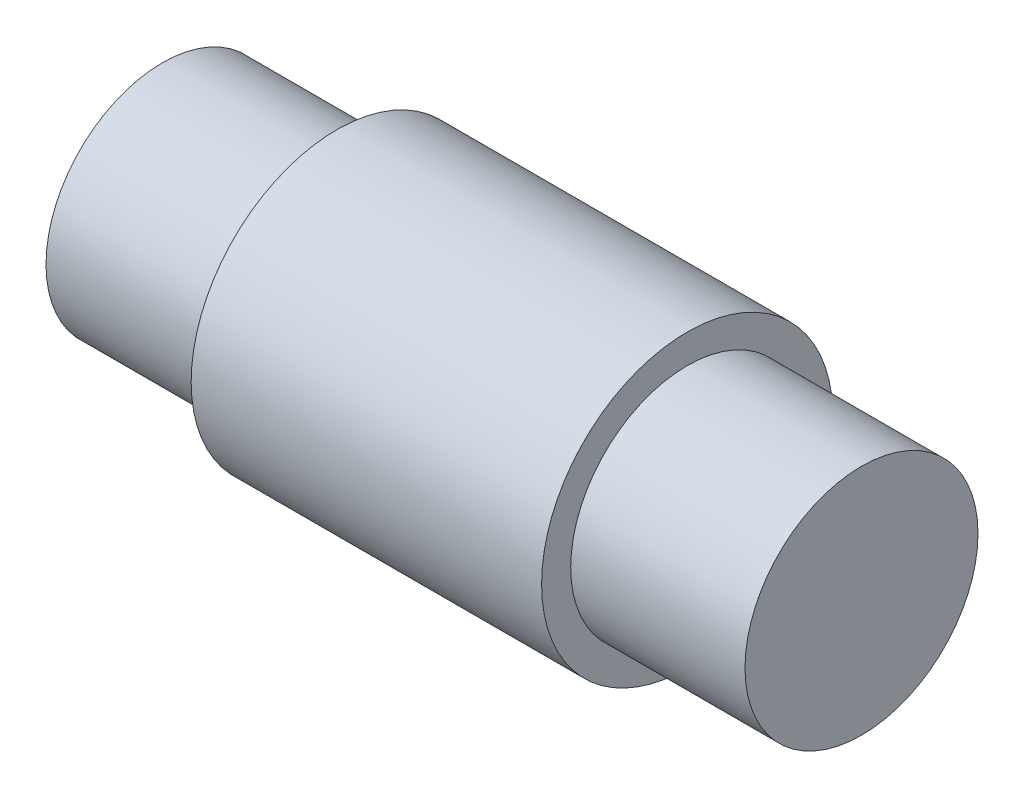
from build123d import *


with BuildPart() as part:
    # Sketch1 → Revolve1 (revolve)
    with BuildSketch(Plane.XY):
        Polygon((-9.525, 0), (-9.525, 3.175), (-4.775, 3.175), (-4.775, 3.96875), (4.775, 3.96875), (4.775, 3.175), (9.525, 3.175), (9.525, 0), align=None)
    revolve(axis=Axis((-76.456488796, 0, 0), (1, 0, 0)))


solid = part.part
